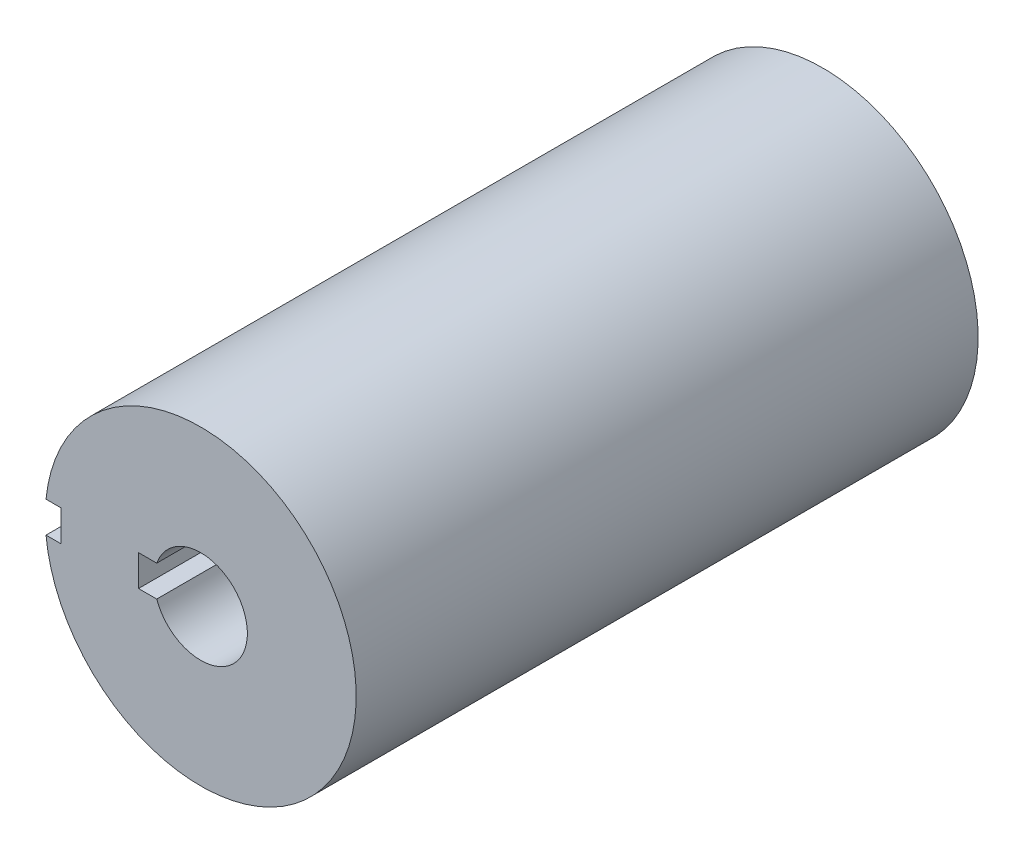
from build123d import *

# Parameters (mm, degrees)
SKETCH5_R           = 5
SKETCH5_R_2         = 1.5
BOSS_EXTRUDE2_DEPTH = 12
SKETCH6_W           = 1
SKETCH6_H           = 1
CUT_EXTRUDE4_DEPTH  = 12
SKETCH7_W           = 1
SKETCH7_H           = 1
CUT_EXTRUDE6_DEPTH  = 4
SKETCH8_W           = 1
SKETCH8_H           = 1
CUT_EXTRUDE7_DEPTH  = 15
BOSS_EXTRUDE3_START = 8
BOSS_EXTRUDE3_DEPTH = 8


with BuildPart() as part:
    # Sketch5 → Boss-Extrude2 (new body)
    with BuildSketch(Plane.XY):
        Circle(SKETCH5_R)
        Circle(SKETCH5_R_2, mode=Mode.SUBTRACT)
    extrude(amount=BOSS_EXTRUDE2_DEPTH)

    # Sketch6 → Cut-Extrude4 (cut)
    with BuildSketch(Plane.XY.offset(12)):
        with Locations((-1.5, 0)):
            Rectangle(SKETCH6_W, SKETCH6_H)
    extrude(amount=-CUT_EXTRUDE4_DEPTH, mode=Mode.SUBTRACT)

    # Sketch7 → Cut-Extrude6 (cut)
    with BuildSketch(Plane.XY.offset(12)):
        with Locations((-5, 0)):
            Rectangle(SKETCH7_W, SKETCH7_H)
    extrude(amount=-CUT_EXTRUDE6_DEPTH, mode=Mode.SUBTRACT)

    # Sketch8 → Cut-Extrude7 (cut)
    with BuildSketch(Plane(origin=(0, 0, 0), x_dir=(-1, 0, 0), z_dir=(0, 0, -1))):
        with Locations((5, 0)):
            Rectangle(SKETCH8_W, SKETCH8_H)
    extrude(amount=-CUT_EXTRUDE7_DEPTH, mode=Mode.SUBTRACT)

    # Sketch10 → Boss-Extrude3 (add)
    with BuildSketch(Plane(origin=(0, 0, 0), x_dir=(-1, 0, 0), z_dir=(0, 0, -1)).offset(BOSS_EXTRUDE3_START)):
        with BuildLine():
            Line((4.5, 0.5), (4.974937186, 0.5))
            ThreePointArc((4.974937186, 0.5), (-5, 0), (4.974937186, -0.5))
            Line((4.974937186, -0.5), (4.5, -0.5))
            Line((4.5, -0.5), (4.5, 0.5))
        make_face()
        with BuildLine():
            ThreePointArc((1.414213562, -0.5), (-1.5, 0), (1.414213562, 0.5))
            Line((1.414213562, 0.5), (2, 0.5))
            Line((2, 0.5), (2, -0.5))
            Line((2, -0.5), (1.414213562, -0.5))
        make_face(mode=Mode.SUBTRACT)
    extrude(amount=-BOSS_EXTRUDE3_DEPTH)


solid = part.part
